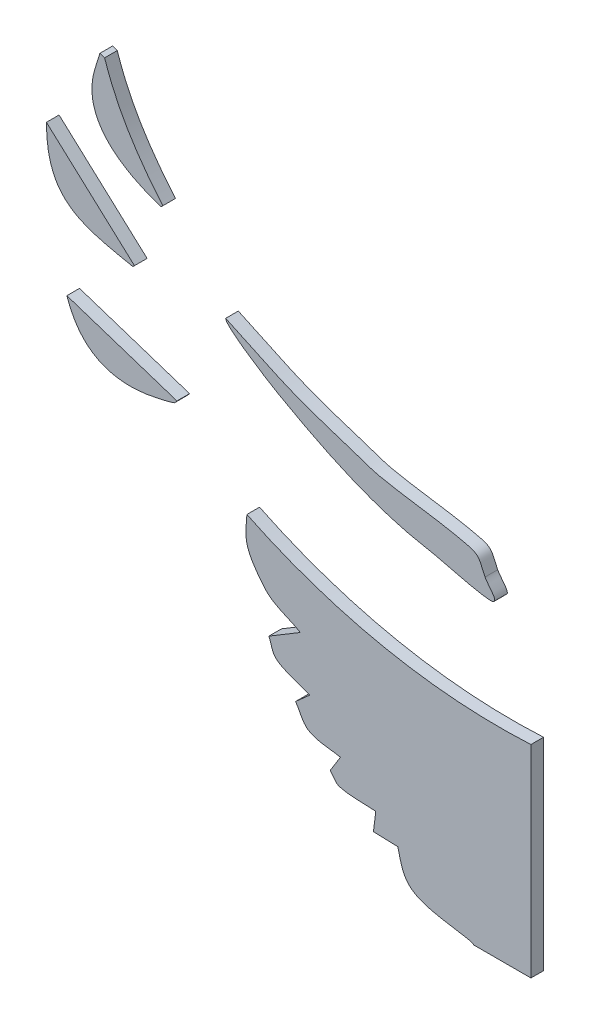
from build123d import *

# Parameters (mm, degrees)
BOSS_EXTRUDE1_DEPTH    = 6.35
BOSS_EXTRUDE1_2_DEPTH  = 6.35
BOSS_EXTRUDE1_3_DEPTH  = 6.35
BOSS_EXTRUDE1_4_DEPTH  = 6.35
BOSS_EXTRUDE1_5_DEPTH  = 6.35
BOSS_EXTRUDE1_6_DEPTH  = 6.35
BOSS_EXTRUDE1_7_DEPTH  = 6.35
BOSS_EXTRUDE1_8_DEPTH  = 6.35
BOSS_EXTRUDE1_9_DEPTH  = 6.35
BOSS_EXTRUDE1_10_DEPTH = 6.35
SPLIT1_DEPTH           = 6.35


# Read off the part's stored shape, not the designer's step: Split1
with BuildPart() as part:
    # Sketch2 → Boss-Extrude1 (new body)
    with BuildSketch(Plane.XY):
        with BuildLine():
            Line((-285.98, 18.17), (-230.68, 0))
            add(Edge.make_bspline(
                [(-230.68, 0), (-231.206666667, -0.526666667), (-231.558572597, -1.329490213), (-232.26, -1.58), (-235.327492085, -2.675532888), (-238.551212656, -3.285669303), (-241.74, -3.95), (-262.618523721, -8.299692442), (-278.996639843, -2.78008047), (-285.98, 18.17)],
                knots=[0, 0, 0, 0, 1, 1, 1, 2, 2, 2, 3, 3, 3, 3], degree=3))
        make_face()
    extrude(amount=BOSS_EXTRUDE1_DEPTH)


with BuildPart() as body_2:
    # Sketch2 → Boss-Extrude1 2 (new body)
    with BuildSketch(Plane.XY):
        with BuildLine():
            Line((-296.25, 88.48), (-252.01, 48.19))
            Line((-252.01, 48.19), (-252.8, 47.4))
            add(Edge.make_bspline(
                [(-252.8, 47.4), (-279.541078637, 52.748215727), (-296.25, 56.11080959), (-296.25, 88.48)],
                knots=[0, 0, 0, 0, 1, 1, 1, 1], degree=3))
        make_face()
    extrude(amount=BOSS_EXTRUDE1_2_DEPTH)


with BuildPart() as body_3:
    # Sketch2 → Boss-Extrude1 3 (new body)
    with BuildSketch(Plane.XY):
        with BuildLine():
            Line((-269.39, 131.93), (-267.02, 131.14))
            add(Edge.make_bspline(
                [(-267.02, 131.14), (-260.55769587, 111.753087609), (-250.910297668, 97.114357202), (-237.79, 81.37)],
                knots=[0, 0, 0, 0, 1, 1, 1, 1], degree=3))
            Line((-237.79, 81.37), (-238.58, 80.58))
            add(Edge.make_bspline(
                [(-238.58, 80.58), (-253.095377484, 85.046269995), (-272.443028073, 95.030561462), (-273.34, 112.97), (-273.723440826, 120.63881651), (-271.351774932, 124.736825248), (-269.39, 131.93)],
                knots=[0, 0, 0, 0, 1, 1, 1, 2, 2, 2, 2], degree=3))
        make_face()
    extrude(amount=BOSS_EXTRUDE1_3_DEPTH)


with BuildPart() as body_4:
    # Sketch2 → Boss-Extrude1 4 (new body)
    with BuildSketch(Plane.XY):
        with BuildLine():
            Line((203.82, 47.4), (205.4, 46.61))
            add(Edge.make_bspline(
                [(205.4, 46.61), (189.902627034, 31.112627034), (157.619256058, 14.619752019), (137.46, 7.9), (128.851925912, 5.030641971), (120.005236712, 2.871745571), (111.39, 0)],
                knots=[0, 0, 0, 0, 1, 1, 1, 2, 2, 2, 2], degree=3))
            add(Edge.make_bspline(
                [(111.39, 0), (112.951599118, 4.684797355), (117.555810635, 8.994391698), (120.87, 12.64), (122.373058722, 14.293364594), (123.531607756, 16.559582009), (125.61, 17.38), (133.75221196, 20.594031037), (142.523487511, 21.915688465), (150.89, 24.49), (169.703996964, 30.278922143), (186.298708698, 38.639354349), (203.82, 47.4)],
                knots=[0, 0, 0, 0, 1, 1, 1, 2, 2, 2, 3, 3, 3, 4, 4, 4, 4], degree=3))
        make_face()
    extrude(amount=BOSS_EXTRUDE1_4_DEPTH)


with BuildPart() as body_5:
    # Sketch2 → Boss-Extrude1 5 (new body)
    with BuildSketch(Plane.XY):
        with BuildLine():
            Line((230.68, 0), (286.77, 17.38))
            add(Edge.make_bspline(
                [(286.77, 17.38), (282.557561371, 8.112635016), (277.914878254, -0.226763547), (267.02, -3.16), (262.630467051, -4.341797332), (258.126406936, -5.237328585), (253.59, -5.53), (246.092331059, -6.013720577), (236.932145523, -4.168097015), (230.68, 0)],
                knots=[0, 0, 0, 0, 1, 1, 1, 2, 2, 2, 3, 3, 3, 3], degree=3))
        make_face()
    extrude(amount=BOSS_EXTRUDE1_5_DEPTH)


with BuildPart() as body_6:
    # Sketch2 → Boss-Extrude1 6 (new body)
    with BuildSketch(Plane.XY):
        with BuildLine():
            Line((252.8, 47.4), (253.59, 49.77))
            Line((253.59, 49.77), (294.67, 88.48))
            Line((294.67, 88.48), (296.25, 87.69))
            add(Edge.make_bspline(
                [(296.25, 87.69), (295.986666667, 82.423333333), (295.959951658, 77.13949241), (295.46, 71.89), (294.492452489, 61.730751132), (279.487087195, 53.479271799), (270.97, 51.35), (264.956930139, 49.846732535), (258.856666667, 48.716666667), (252.8, 47.4)],
                knots=[0, 0, 0, 0, 1, 1, 1, 2, 2, 2, 3, 3, 3, 3], degree=3))
        make_face()
    extrude(amount=BOSS_EXTRUDE1_6_DEPTH)


with BuildPart() as body_7:
    # Sketch2 → Boss-Extrude1 7 (new body)
    with BuildSketch(Plane.XY):
        with BuildLine():
            Line((-168.665, -69.75), (-184.465, -79.23))
            add(Edge.make_bspline(
                [(-184.465, -79.23), (-183.148333333, -81.995), (-182.964990839, -85.687506871), (-180.515, -87.525), (-175.701831397, -91.134876452), (-169.455, -92.265), (-163.925, -94.635)],
                knots=[0, 0, 0, 0, 1, 1, 1, 2, 2, 2, 2], degree=3))
            Line((-163.925, -94.635), (-171.035, -100.955))
            add(Edge.make_bspline(
                [(-171.035, -100.955), (-168.796666667, -104.115), (-167.67130517, -108.494770691), (-164.32, -110.435), (-159.648140436, -113.1397608), (-153.786666667, -112.805), (-148.52, -113.99)],
                knots=[0, 0, 0, 0, 1, 1, 1, 2, 2, 2, 2], degree=3))
            Line((-148.52, -113.99), (-153.655, -122.285))
            add(Edge.make_bspline(
                [(-153.655, -122.285), (-152.075, -123.865), (-151.069000467, -126.430792975), (-148.915, -127.025), (-143.054385579, -128.64172122), (-136.801666667, -128.078333333), (-130.745, -128.605)],
                knots=[0, 0, 0, 0, 1, 1, 1, 2, 2, 2, 2], degree=3))
            Line((-130.745, -128.605), (-131.93, -138.085))
            Line((-131.93, -138.085), (-119.685, -138.48))
            add(Edge.make_bspline(
                [(-119.685, -138.48), (-117.925315647, -145.166800543), (-117.329428877, -151.95746902), (-109.415, -155.465), (-101.150233459, -159.127794262), (-91.741548458, -159.284981355), (-82.95, -161.39), (-82.377354855, -161.527112218), (-81.896666667, -161.916666667), (-81.37, -162.18)],
                knots=[0, 0, 0, 0, 1, 1, 1, 2, 2, 2, 3, 3, 3, 3], degree=3))
            Line((-81.37, -162.18), (-52.795, -162.18))
            Line((-52.795, -162.18), (-52.795, -60.58))
            ThreePointArc((-52.795, -60.58), (-125.98001318, -55.240494998), (-195.525, -31.83))
            add(Edge.make_bspline(
                [(-195.525, -31.83), (-196.411209149, -42.46450979), (-197.436532474, -46.178786553), (-186.835, -59.085), (-182.377283456, -64.511785358), (-174.721666667, -66.195), (-168.665, -69.75)],
                knots=[0, 0, 0, 0, 1, 1, 1, 2, 2, 2, 2], degree=3))
        make_face()
    extrude(amount=BOSS_EXTRUDE1_7_DEPTH)


with BuildPart() as body_8:
    # Sketch2 → Boss-Extrude1 8 (new body)
    with BuildSketch(Plane.XY):
        with BuildLine():
            Line((52.795, -162.18), (52.795, -60.58))
            ThreePointArc((52.795, -60.58), (125.98001318, -55.240494998), (195.525, -31.83))
            add(Edge.make_bspline(
                [(195.525, -31.83), (196.411209149, -42.46450979), (197.436532474, -46.178786553), (186.835, -59.085), (182.377283456, -64.511785358), (174.721666667, -66.195), (168.665, -69.75)],
                knots=[0, 0, 0, 0, 1, 1, 1, 2, 2, 2, 2], degree=3))
            Line((168.665, -69.75), (184.465, -79.23))
            add(Edge.make_bspline(
                [(184.465, -79.23), (183.148333333, -81.995), (182.964990839, -85.687506871), (180.515, -87.525), (175.701831397, -91.134876452), (169.455, -92.265), (163.925, -94.635)],
                knots=[0, 0, 0, 0, 1, 1, 1, 2, 2, 2, 2], degree=3))
            Line((163.925, -94.635), (171.035, -100.955))
            add(Edge.make_bspline(
                [(171.035, -100.955), (168.796666667, -104.115), (167.67130517, -108.494770691), (164.32, -110.435), (159.648140436, -113.1397608), (153.786666667, -112.805), (148.52, -113.99)],
                knots=[0, 0, 0, 0, 1, 1, 1, 2, 2, 2, 2], degree=3))
            Line((148.52, -113.99), (153.655, -122.285))
            add(Edge.make_bspline(
                [(153.655, -122.285), (152.075, -123.865), (151.069000467, -126.430792975), (148.915, -127.025), (143.054385579, -128.64172122), (136.801666667, -128.078333333), (130.745, -128.605)],
                knots=[0, 0, 0, 0, 1, 1, 1, 2, 2, 2, 2], degree=3))
            Line((130.745, -128.605), (131.93, -138.085))
            Line((131.93, -138.085), (119.685, -138.48))
            add(Edge.make_bspline(
                [(119.685, -138.48), (117.925315647, -145.166800543), (117.329428877, -151.95746902), (109.415, -155.465), (101.150233459, -159.127794262), (91.741548458, -159.284981355), (82.95, -161.39), (82.377354855, -161.527112218), (81.896666667, -161.916666667), (81.37, -162.18)],
                knots=[0, 0, 0, 0, 1, 1, 1, 2, 2, 2, 3, 3, 3, 3], degree=3))
            Line((81.37, -162.18), (52.795, -162.18))
        make_face()
    extrude(amount=BOSS_EXTRUDE1_8_DEPTH)


with BuildPart() as body_9:
    # Sketch2 → Boss-Extrude1 9 (new body)
    with BuildSketch(Plane.XY):
        with BuildLine():
            add(Edge.make_bspline(
                [(256.75, 88.48), (250.12671535, 84.0644769), (238.762555045, 80.306167432), (238.58, 80.58), (237.223198026, 82.615202961), (246.50041369, 91.060572801), (248.06, 93.22), (257.1238936, 105.770006524), (262.898177022, 117.984531066), (267.81, 132.72)],
                knots=[3, 3, 3, 3, 4, 4, 4, 5, 5, 5, 6, 6, 6, 6], degree=3))
            add(Edge.make_bspline(
                [(267.81, 132.72), (268.336666667, 132.456666667), (269.158048013, 132.471221302), (269.39, 131.93), (270.800908854, 128.637879342), (271.961168766, 125.192987404), (272.55, 121.66), (275.167745927, 105.953524436), (269.960238325, 97.28682555), (256.75, 88.48)],
                knots=[0, 0, 0, 0, 1, 1, 1, 2, 2, 2, 3, 3, 3, 3], degree=3))
        make_face()
    extrude(amount=BOSS_EXTRUDE1_9_DEPTH)


with BuildPart() as body_10:
    # Sketch2 → Boss-Extrude1 10 (new body)
    with BuildSketch(Plane.XY):
        with BuildLine():
            add(Edge.make_bspline(
                [(-75.84, 0.79), (-74.417025026, -2.055949949), (-68.88676657, -6.848868299), (-71.89, -7.9), (-74.865535436, -8.941437403), (-94.225284948, -3.896178763), (-100.33, -2.37), (-106.320431812, -0.872392047), (-108.717916656, -0.865520836), (-115.34, 0.79), (-138.429163032, 6.562290758), (-160.267284552, 17.434162601), (-180.91, 29.23), (-185.170307148, 31.664461227), (-206.19, 44.720230322), (-206.19, 48.19)],
                knots=[5, 5, 5, 5, 6, 6, 6, 7, 7, 7, 8, 8, 8, 9, 9, 9, 10, 10, 10, 10], degree=3))
            add(Edge.make_bspline(
                [(-206.19, 48.19), (-192.515030028, 42.112235568), (-179.428985916, 35.03164507), (-165.11, 30.02), (-158.036160999, 27.544156349), (-150.936267738, 25.136394407), (-143.78, 22.91), (-138.769981559, 21.351327596), (-133.902676573, 19.258749576), (-128.77, 18.17), (-114.585314112, 15.161127236), (-98.767232827, 13.829308207), (-84.53, 10.27), (-78.215639202, 8.6914098), (-78.779621344, 6.669242689), (-75.84, 0.79)],
                knots=[0, 0, 0, 0, 1, 1, 1, 2, 2, 2, 3, 3, 3, 4, 4, 4, 5, 5, 5, 5], degree=3))
        make_face()
    extrude(amount=BOSS_EXTRUDE1_10_DEPTH)


with BuildPart() as split1_tool:
    # Split1 outline → Split1 (new body)
    with BuildSketch(Plane.XY):
        with BuildLine():
            Line((184.465, -79.23), (168.665, -69.75))
            add(Edge.make_bspline(
                [(168.665, -69.75), (174.721666667, -66.195), (182.377283456, -64.511785358), (186.835, -59.085), (197.436532474, -46.178786553), (196.411209149, -42.46450979), (195.525, -31.83)],
                knots=[0, 0, 0, 0, 1, 1, 1, 2, 2, 2, 2], degree=3))
            ThreePointArc((195.525, -31.83), (125.98001318, -55.240494998), (52.795, -60.58))
            Line((52.795, -60.58), (52.795, -162.18))
            Line((52.795, -162.18), (81.37, -162.18))
            add(Edge.make_bspline(
                [(81.37, -162.18), (81.896666667, -161.916666667), (82.377354855, -161.527112218), (82.95, -161.39), (91.741548458, -159.284981355), (101.150233459, -159.127794262), (109.415, -155.465), (117.329428877, -151.95746902), (117.925315647, -145.166800543), (119.685, -138.48)],
                knots=[0, 0, 0, 0, 1, 1, 1, 2, 2, 2, 3, 3, 3, 3], degree=3))
            Line((119.685, -138.48), (131.93, -138.085))
            Line((131.93, -138.085), (130.745, -128.605))
            add(Edge.make_bspline(
                [(130.745, -128.605), (136.801666667, -128.078333333), (143.054385579, -128.64172122), (148.915, -127.025), (151.069000467, -126.430792975), (152.075, -123.865), (153.655, -122.285)],
                knots=[0, 0, 0, 0, 1, 1, 1, 2, 2, 2, 2], degree=3))
            Line((153.655, -122.285), (148.52, -113.99))
            add(Edge.make_bspline(
                [(148.52, -113.99), (153.786666667, -112.805), (159.648140436, -113.1397608), (164.32, -110.435), (167.67130517, -108.494770691), (168.796666667, -104.115), (171.035, -100.955)],
                knots=[0, 0, 0, 0, 1, 1, 1, 2, 2, 2, 2], degree=3))
            Line((171.035, -100.955), (163.925, -94.635))
            add(Edge.make_bspline(
                [(163.925, -94.635), (169.455, -92.265), (175.701831397, -91.134876452), (180.515, -87.525), (182.964990839, -85.687506871), (183.148333333, -81.995), (184.465, -79.23)],
                knots=[0, 0, 0, 0, 1, 1, 1, 2, 2, 2, 2], degree=3))
        make_face()
        with BuildLine():
            add(Edge.make_bspline(
                [(267.81, 132.72), (262.898177022, 117.984531066), (257.1238936, 105.770006524), (248.06, 93.22), (246.50041369, 91.060572801), (237.223198026, 82.615202961), (238.58, 80.58), (238.762555045, 80.306167432), (250.12671535, 84.0644769), (256.75, 88.48)],
                knots=[3, 3, 3, 3, 4, 4, 4, 5, 5, 5, 6, 6, 6, 6], degree=3))
            add(Edge.make_bspline(
                [(256.75, 88.48), (269.960238325, 97.28682555), (275.167745927, 105.953524436), (272.55, 121.66), (271.961168766, 125.192987404), (270.800908854, 128.637879342), (269.39, 131.93), (269.158048013, 132.471221302), (268.336666667, 132.456666667), (267.81, 132.72)],
                knots=[0, 0, 0, 0, 1, 1, 1, 2, 2, 2, 3, 3, 3, 3], degree=3))
        make_face()
        with BuildLine():
            Line((205.4, 46.61), (203.82, 47.4))
            add(Edge.make_bspline(
                [(203.82, 47.4), (186.298708698, 38.639354349), (169.703996964, 30.278922143), (150.89, 24.49), (142.523487511, 21.915688465), (133.75221196, 20.594031037), (125.61, 17.38), (123.531607756, 16.559582009), (122.373058722, 14.293364594), (120.87, 12.64), (117.555810635, 8.994391698), (112.951599118, 4.684797355), (111.39, 0)],
                knots=[0, 0, 0, 0, 1, 1, 1, 2, 2, 2, 3, 3, 3, 4, 4, 4, 4], degree=3))
            add(Edge.make_bspline(
                [(111.39, 0), (120.005236712, 2.871745571), (128.851925912, 5.030641971), (137.46, 7.9), (157.619256058, 14.619752019), (189.902627034, 31.112627034), (205.4, 46.61)],
                knots=[0, 0, 0, 0, 1, 1, 1, 2, 2, 2, 2], degree=3))
        make_face()
        with BuildLine():
            Line((253.59, 49.77), (252.8, 47.4))
            add(Edge.make_bspline(
                [(252.8, 47.4), (258.856666667, 48.716666667), (264.956930139, 49.846732535), (270.97, 51.35), (279.487087195, 53.479271799), (294.492452489, 61.730751132), (295.46, 71.89), (295.959951658, 77.13949241), (295.986666667, 82.423333333), (296.25, 87.69)],
                knots=[0, 0, 0, 0, 1, 1, 1, 2, 2, 2, 3, 3, 3, 3], degree=3))
            Line((296.25, 87.69), (294.67, 88.48))
            Line((294.67, 88.48), (253.59, 49.77))
        make_face()
        with BuildLine():
            Line((286.77, 17.38), (230.68, 0))
            add(Edge.make_bspline(
                [(230.68, 0), (236.932145523, -4.168097015), (246.092331059, -6.013720577), (253.59, -5.53), (258.126406936, -5.237328585), (262.630467051, -4.341797332), (267.02, -3.16), (277.914878254, -0.226763547), (282.557561371, 8.112635016), (286.77, 17.38)],
                knots=[0, 0, 0, 0, 1, 1, 1, 2, 2, 2, 3, 3, 3, 3], degree=3))
        make_face()
    extrude(amount=SPLIT1_DEPTH)


with BuildPart() as body_4_1:
    add(body_4.part)

    # Split1: cut by split1_tool
    add(split1_tool.part, mode=Mode.SUBTRACT)


with BuildPart() as body_5_1:
    add(body_5.part)

    # Split1: cut by split1_tool
    add(split1_tool.part, mode=Mode.SUBTRACT)


with BuildPart() as body_6_1:
    add(body_6.part)

    # Split1: cut by split1_tool
    add(split1_tool.part, mode=Mode.SUBTRACT)


with BuildPart() as body_8_1:
    add(body_8.part)

    # Split1: cut by split1_tool
    add(split1_tool.part, mode=Mode.SUBTRACT)


with BuildPart() as body_9_1:
    add(body_9.part)

    # Split1: cut by split1_tool
    add(split1_tool.part, mode=Mode.SUBTRACT)


solid = Compound([part.part, body_2.part, body_3.part, body_7.part, body_10.part])
